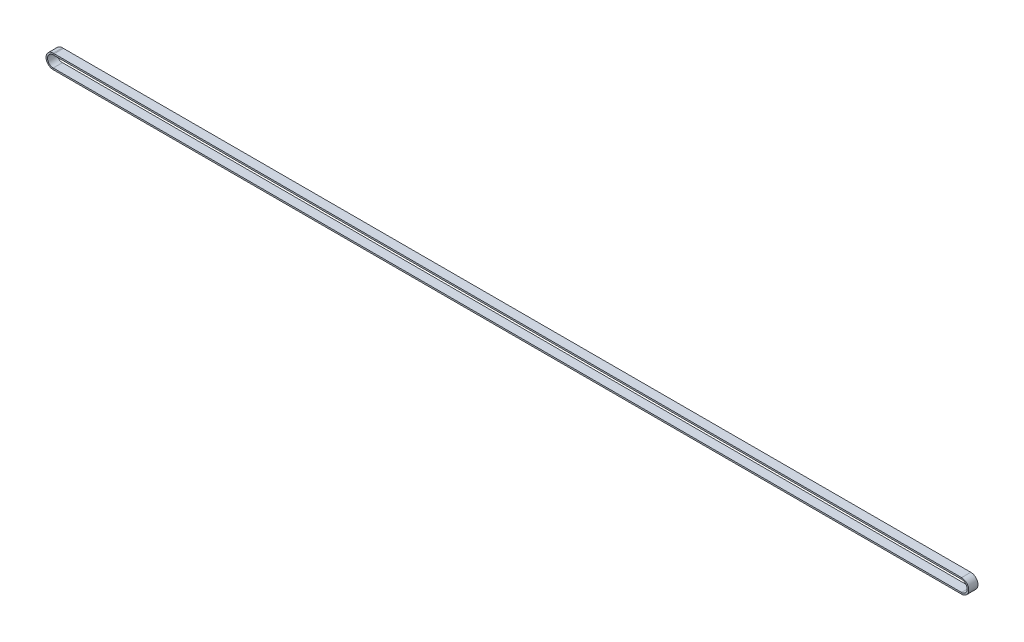
from build123d import *

# Parameters (mm, degrees)
SKETCH3_W = 9
SKETCH3_H = 1.5


with BuildPart() as part:
    # Sweep1: sweep along a path in Sketch2
    with BuildLine(Plane.XY) as sweep1_path:
        Line((-1, -84.243047008), (883.520420179, -84.243047008))
        ThreePointArc((883.520420179, -84.243047008), (890.520420179, -91.243047008), (883.520420179, -98.243047008))
        Line((883.520420179, -98.243047008), (-1, -98.243047008))
        ThreePointArc((-1, -98.243047008), (-8, -91.243047008), (-1, -84.243047008))
    # Sketch3 → Sweep1 (sweep)
    with BuildSketch(Plane(origin=(0, 0, 0), x_dir=(0, 0, -1), z_dir=(1, 0, 0))):
        with Locations((-4.5, -84.993047008)):
            Rectangle(SKETCH3_W, SKETCH3_H)
    sweep(path=sweep1_path.line)


solid = part.part
